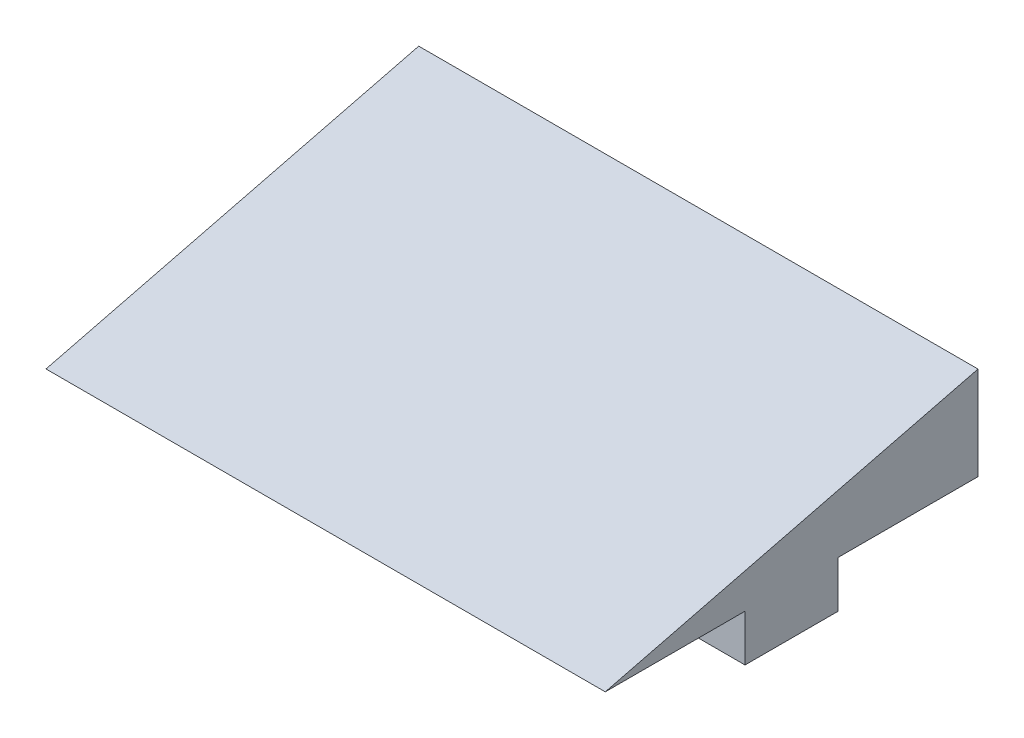
from build123d import *

# Parameters (mm, degrees)
SKETCH3_W               = 120
SKETCH3_H               = 80
BOSS_EXTRUDE1_DEPTH     = 20
CUT_EXTRUDE3_DEPTH      = 129.062484749
CUT_EXTRUDE3_DEPTH_BACK = 120
SKETCH5_W               = 20
SKETCH5_H               = 10
BOSS_EXTRUDE2_DEPTH     = 120


with BuildPart() as part:
    # Sketch3 → Boss-Extrude1 (new body)
    with BuildSketch(Plane(origin=(0, 0, 0), x_dir=(1, 0, 0), z_dir=(0, 1, 0))):
        Rectangle(SKETCH3_W, SKETCH3_H)
    extrude(amount=BOSS_EXTRUDE1_DEPTH)

    # Sketch4 → Cut-Extrude3 (cut, two sides: drawn at the far end of the back side and taken through both)
    with BuildSketch(Plane(origin=(60, 0, 0), x_dir=(0, 0, -1), z_dir=(1, 0, 0)).offset(-CUT_EXTRUDE3_DEPTH_BACK)):
        Polygon((-40, 20), (-40, 0), (-39.971354494, 0), (40, 20), align=None)
    extrude(amount=CUT_EXTRUDE3_DEPTH + CUT_EXTRUDE3_DEPTH_BACK, mode=Mode.SUBTRACT)

    # Sketch5 → Boss-Extrude2 (add)
    with BuildSketch(Plane(origin=(60, 0, 0), x_dir=(0, 0, -1), z_dir=(1, 0, 0))):
        with Locations((0.014322753, -5)):
            Rectangle(SKETCH5_W, SKETCH5_H)
    extrude(amount=-BOSS_EXTRUDE2_DEPTH)


solid = part.part
